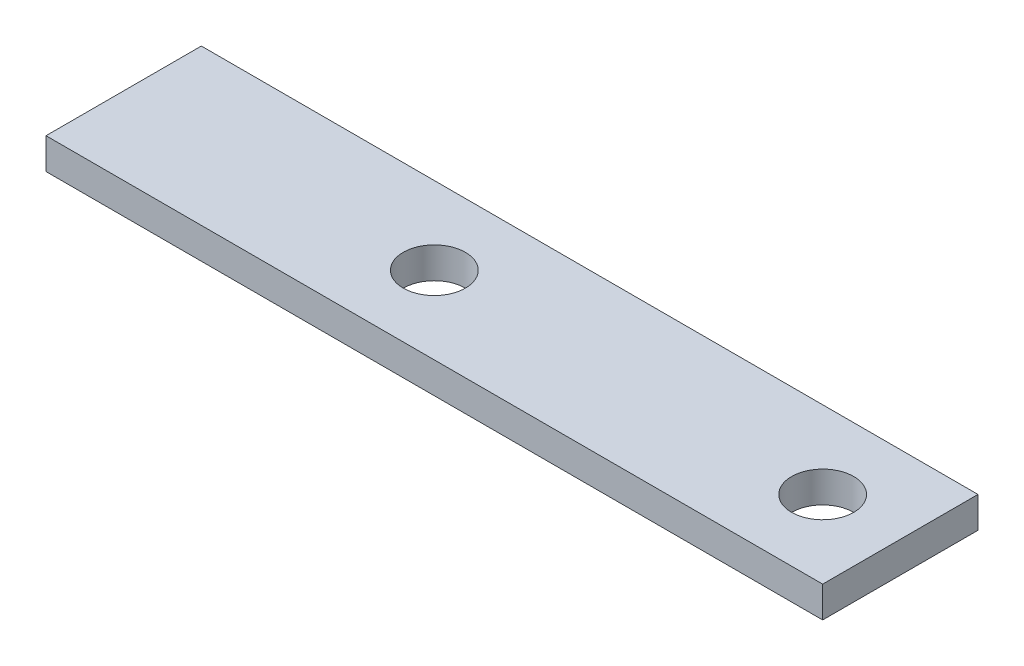
from build123d import *

# Parameters (mm, degrees)
SKETCH_1_W          = 20
SKETCH_1_H          = 4
EXTRUDE_1_DEPTH     = 100
SKETCH_2_R          = 4
CUT_EXTRUDE_1_DEPTH = 103.058806577


with BuildPart() as part:
    # Эскиз1 → Вытянуть-Тонкостенный1 (new body)
    with BuildSketch(Plane(origin=(0, 0, 0), x_dir=(0, 0, -1), z_dir=(1, 0, 0))):
        with Locations((10, -2)):
            Rectangle(SKETCH_1_W, SKETCH_1_H)
    extrude(amount=EXTRUDE_1_DEPTH)

    # Эскиз2 → Вырез-Вытянуть1 (cut, through all)
    with BuildSketch(Plane(origin=(0, 0, 0), x_dir=(1, 0, 0), z_dir=(0, 1, 0))):
        with Locations((90, 10)):
            Circle(SKETCH_2_R)
        with Locations((40, 10)):
            Circle(SKETCH_2_R)
    extrude(amount=-CUT_EXTRUDE_1_DEPTH, mode=Mode.SUBTRACT)


solid = part.part
